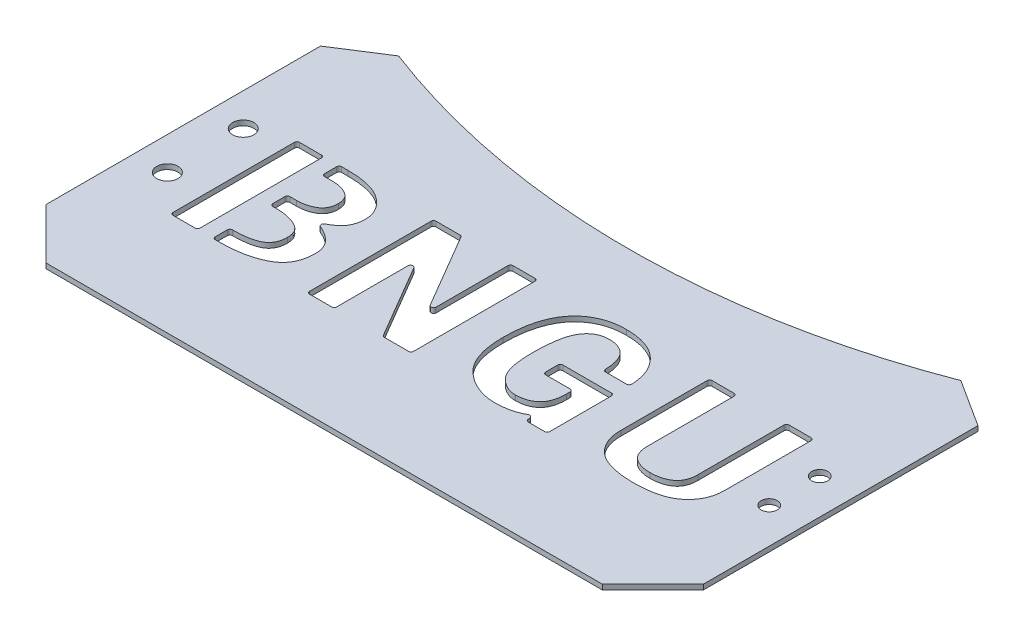
from build123d import *

# Parameters (mm, degrees)
SKETCH_1_W            = 130
SKETCH_1_H            = 75
EXTRUDE_1_DEPTH       = 1
SKETCH_2_R            = 155
CUT_EXTRUDE_1_DEPTH   = 10
CHAMFER_1_SIZE        = 10
SKETCH_3_R            = 2.1
SKETCH_3_R_2          = 1.6
CUT_EXTRUDE_2_DEPTH   = 10
CUT_EXTRUDE_START     = -2
CUT_EXTRUDE_4_DEPTH   = 3
CUT_EXTRUDE_START_2   = -1
CUT_EXTRUDE_4_2_DEPTH = 1
CUT_EXTRUDE_4_3_DEPTH = 1
SKETCH_5_W            = 3
SKETCH_5_H            = 25
EXTRUDE_2_DEPTH       = 1
FILLET_2_R            = 0.5


with BuildPart() as part:
    # 草图1 → 凸台-拉伸1 (new body)
    with BuildSketch(Plane(origin=(0, 0, 0), x_dir=(1, 0, 0), z_dir=(0, 1, 0))):
        with Locations((65, 37.5)):
            Rectangle(SKETCH_1_W, SKETCH_1_H)
    extrude(amount=EXTRUDE_1_DEPTH)

    # 草图2 → 切除-拉伸1 (cut)
    with BuildSketch(Plane(origin=(0, 1, 0), x_dir=(1, 0, 0), z_dir=(0, 1, 0))):
        with Locations((65, 215)):
            Circle(SKETCH_2_R)
    extrude(amount=-CUT_EXTRUDE_1_DEPTH, mode=Mode.SUBTRACT)

    # 倒角1
    # the kernel refuses this chamfer: 10 mm, written as the material it takes off along each edge
    with BuildSketch(Plane(origin=(0, -26.132062539, -74.287527205), x_dir=(0, 0, 1), z_dir=(0, 1, 0))) as chamfer_1_piece_1:
        with BuildLine():
            Line((CHAMFER_1_SIZE, 0), (3.978000417, 9.41522725))
            ThreePointArc((3.978000417, 9.41522725), (2.110742206, 4.779328659), (0, 0))
            Line((0, 0), (CHAMFER_1_SIZE, 0))
        make_face()
    extrude(amount=53.264125079, mode=Mode.SUBTRACT)
    with BuildSketch(Plane(origin=(130, -26.132062539, -74.287527205), x_dir=(0, 0, 1), z_dir=(0, 1, 0))) as chamfer_1_piece_2:
        with BuildLine():
            Line((CHAMFER_1_SIZE, 0), (3.978000417, -9.41522725))
            ThreePointArc((3.978000417, -9.41522725), (2.110742206, -4.779328659), (0, 0))
            Line((0, 0), (CHAMFER_1_SIZE, 0))
        make_face()
    extrude(amount=53.264125079, mode=Mode.SUBTRACT)
    with BuildSketch(Plane(origin=(130, -25.71682988, 0), x_dir=(-1, 0, 0), z_dir=(0, 1, 0))) as chamfer_1_piece_3:
        Polygon((CHAMFER_1_SIZE, 0), (0, -CHAMFER_1_SIZE), (0, 0), align=None)
    extrude(amount=52.433659759, mode=Mode.SUBTRACT)
    with BuildSketch(Plane(origin=(0, -25.71682988, 0), x_dir=(1, 0, 0), z_dir=(0, 1, 0))) as chamfer_1_piece_4:
        Polygon((CHAMFER_1_SIZE, 0), (0, CHAMFER_1_SIZE), (0, 0), align=None)
    extrude(amount=52.433659759, mode=Mode.SUBTRACT)

    # 草图3 → 切除-拉伸2 (cut)
    with BuildSketch(Plane(origin=(0, 1, 0), x_dir=(1, 0, 0), z_dir=(0, 1, 0))):
        with Locations(Location((6.5, 42.5, 0), (0, 0, 270))):
            Circle(SKETCH_3_R)
        with Locations(Location((6.5, 27.5, 0), (0, 0, 270))):
            Circle(SKETCH_3_R)
        with Locations(Location((123, 40, 0), (0, 0, 270))):
            Circle(SKETCH_3_R_2)
        with Locations(Location((123, 30, 0), (0, 0, 270))):
            Circle(SKETCH_3_R_2)
    extrude(amount=-CUT_EXTRUDE_2_DEPTH, mode=Mode.SUBTRACT)

    # 切除-拉伸4: read off the stored shape, not the designer's step
    # 切除-拉伸4 outline → 切除-拉伸4 (cut)
    with BuildSketch(Plane(origin=(0, 1, 0), x_dir=(1, 0, 0), z_dir=(0, 1, 0)).offset(CUT_EXTRUDE_START)):
        with BuildLine():
            add(Edge.make_bspline(
                [(116.063532947, 28.166988624), (116.057192042, 27.883930004), (116.044812515, 27.331306767), (115.922044318, 26.521952572), (115.725747652, 25.755294927), (115.449111567, 25.027888373), (115.096143998, 24.342898255), (114.652061594, 23.706177355), (114.144232404, 23.101601638), (113.548858846, 22.545977268), (112.86986428, 22.044697624), (112.098907478, 21.607876999), (111.239236611, 21.23795111), (110.283790651, 20.947353164), (109.244132409, 20.710422452), (108.111652791, 20.549437286), (106.891526925, 20.444418805), (106.047315121, 20.434438821), (105.610646061, 20.429276669)],
                knots=[0, 0, 0, 0, 0.057606053, 0.112465904, 0.166267195, 0.21849059, 0.270622449, 0.322754308, 0.376247712, 0.431136575, 0.488177917, 0.547722751, 0.611189064, 0.678352216, 0.75080903, 0.828127925, 0.911099067, 1, 1, 1, 1], degree=3))
            Line((116.063532947, 28.166988624), (116.063532947, 45.713672462))
            Line((116.063532947, 45.713672462), (110.713672462, 45.713672462))
            Line((110.713672462, 45.713672462), (110.713672462, 28.166988624))
            add(Edge.make_bspline(
                [(105.610646061, 23.815196394), (105.800309969, 23.818334705), (106.169553382, 23.824444463), (106.708231203, 23.870404409), (107.215789081, 23.96137352), (107.697807881, 24.066175339), (108.146667307, 24.22391612), (108.572672211, 24.395213821), (108.965341848, 24.612138371), (109.325835252, 24.860598369), (109.659542865, 25.135723994), (109.935545294, 25.464937776), (110.185045369, 25.819296489), (110.37227815, 26.221633738), (110.533178929, 26.652385273), (110.63706226, 27.125534223), (110.702249028, 27.633904249), (110.709796598, 27.986118085), (110.713672462, 28.166988624)],
                knots=[0, 0, 0, 0, 0.074422878, 0.144888702, 0.21180878, 0.276669399, 0.338145927, 0.398232677, 0.456652738, 0.513690587, 0.569945868, 0.625668911, 0.681731236, 0.739485653, 0.799206506, 0.861857597, 0.929060451, 1, 1, 1, 1], degree=3))
            add(Edge.make_bspline(
                [(100.851040996, 28.166988624), (100.8553661, 27.977245834), (100.863712135, 27.611104406), (100.921620885, 27.08278416), (101.022433778, 26.597000171), (101.16645085, 26.153290963), (101.355342629, 25.753737658), (101.582992925, 25.394032486), (101.8501067, 25.075678795), (102.163772151, 24.805198635), (102.504878131, 24.571032965), (102.876542284, 24.370688369), (103.271375159, 24.19946188), (103.69258233, 24.062214509), (104.133984119, 23.944953664), (104.603752707, 23.875177415), (105.097934511, 23.823271974), (105.43699421, 23.817931537), (105.610646061, 23.815196394)],
                knots=[0, 0, 0, 0, 0.077065754, 0.148711658, 0.215539497, 0.278260375, 0.3377329, 0.394568739, 0.450755432, 0.50584162, 0.562267356, 0.618510386, 0.677084165, 0.736817934, 0.798315038, 0.862335277, 0.929494027, 1, 1, 1, 1], degree=3))
            Line((100.851040996, 28.166988624), (100.851040996, 45.713672462))
            Line((100.851040996, 45.713672462), (95.501180511, 45.713672462))
            Line((95.501180511, 45.713672462), (95.501180511, 28.166988624))
            add(Edge.make_bspline(
                [(105.610646061, 20.429276669), (105.191940478, 20.435290769), (104.380177209, 20.446950573), (103.205486092, 20.541017013), (102.118064786, 20.709045345), (101.112890912, 20.929272192), (100.195789242, 21.22449067), (99.359060918, 21.577989057), (98.609703349, 22.000321988), (97.950353748, 22.493723601), (97.372964163, 23.039477347), (96.868717983, 23.631001493), (96.449088521, 24.277449871), (96.097685957, 24.964714028), (95.827756668, 25.699931831), (95.643159777, 26.482041981), (95.519778802, 27.308100876), (95.507465048, 27.876762394), (95.501180511, 28.166988624)],
                knots=[0, 0, 0, 0, 0.086825254, 0.168332008, 0.244136288, 0.314865598, 0.3814941, 0.443641672, 0.502945796, 0.559400955, 0.613978807, 0.667408917, 0.72018612, 0.773435671, 0.827182861, 0.882151317, 0.939853889, 1, 1, 1, 1], degree=3))
        make_face()
        with BuildLine():
            add(Edge.make_bspline(
                [(84.137153896, 22.42004722), (84.120342777, 22.358077737), (84.085378654, 22.229192284), (83.970677764, 22.048081956), (83.804015819, 21.875517016), (83.586963373, 21.706043635), (83.323666256, 21.534510074), (83.009363536, 21.367853594), (82.641852705, 21.209272818), (82.085358891, 20.994220643), (81.333490055, 20.769312454), (80.393402441, 20.570373117), (79.414735309, 20.44862376), (78.75008353, 20.435803897), (78.411676325, 20.429276669)],
                knots=[0, 0, 0, 0, 0.030348462, 0.063119378, 0.100370879, 0.143874274, 0.193576006, 0.249427436, 0.312547593, 0.383520624, 0.532625821, 0.684532024, 0.839379598, 1, 1, 1, 1], degree=3))
            Line((84.137153896, 22.42004722), (84.534234814, 20.429276669))
            Line((84.534234814, 20.429276669), (88.676754668, 20.429276669))
            Line((88.676754668, 20.429276669), (88.676754668, 33.629534235))
            Line((88.676754668, 33.629534235), (78.06825499, 33.629534235))
            Line((78.06825499, 33.629534235), (78.06825499, 30.238248551))
            Line((78.06825499, 30.238248551), (83.890319811, 30.238248551))
            Line((83.890319811, 30.238248551), (83.890319811, 29.020176003))
            add(Edge.make_bspline(
                [(78.975101953, 23.815196394), (79.161299754, 23.819483702), (79.525702533, 23.827874278), (80.056578865, 23.888435493), (80.558953477, 23.981259058), (81.025513068, 24.124890327), (81.467157777, 24.29173572), (81.867627281, 24.516504784), (82.244037921, 24.769672897), (82.588644327, 25.0645182), (82.89616294, 25.405799986), (83.166128031, 25.788621257), (83.393738924, 26.21748476), (83.573003841, 26.692877232), (83.719861312, 27.211170671), (83.819135252, 27.775654293), (83.877589497, 28.38396236), (83.88598651, 28.803613747), (83.890319811, 29.020176003)],
                knots=[0, 0, 0, 0, 0.068189377, 0.133451623, 0.195514404, 0.255006289, 0.312067396, 0.368069228, 0.422768152, 0.478056409, 0.533719951, 0.590615313, 0.649234943, 0.711044752, 0.776382595, 0.846293993, 0.920679591, 1, 1, 1, 1], degree=3))
            add(Edge.make_bspline(
                [(73.464262717, 32.717321314), (73.468844868, 32.298618019), (73.477626855, 31.496146135), (73.559377768, 30.344492057), (73.686230152, 29.298105238), (73.88166181, 28.359159708), (74.117407911, 27.523449787), (74.411500505, 26.790430515), (74.761669702, 26.162726397), (75.173985784, 25.645675984), (75.614044271, 25.215190891), (76.065841336, 24.845684574), (76.522106115, 24.524536069), (76.991335062, 24.264650375), (77.472651194, 24.065435488), (77.962899043, 23.918648563), (78.465640338, 23.829377755), (78.804824879, 23.819936222), (78.975101953, 23.815196394)],
                knots=[0, 0, 0, 0, 0.106838532, 0.204762941, 0.294503275, 0.375611329, 0.449285761, 0.515827233, 0.576748549, 0.63199848, 0.683966024, 0.733587143, 0.780818079, 0.826174366, 0.870171136, 0.913499803, 0.95657526, 1, 1, 1, 1], degree=3))
            add(Edge.make_bspline(
                [(78.787293411, 42.61214853), (78.581163382, 42.606707429), (78.178744488, 42.596085001), (77.592309404, 42.491150779), (77.043165666, 42.318484405), (76.524576102, 42.083493194), (76.053407966, 41.764235634), (75.604770233, 41.393935922), (75.205086306, 40.942764973), (74.833765463, 40.425824164), (74.500712998, 39.821651542), (74.229667845, 39.111406603), (73.985124041, 38.303778458), (73.79982734, 37.386647352), (73.642293241, 36.368260519), (73.540287435, 35.242815644), (73.475173822, 34.014878826), (73.467993604, 33.161001441), (73.464262717, 32.717321314)],
                knots=[0, 0, 0, 0, 0.048895668, 0.095456935, 0.140847685, 0.185301326, 0.230052062, 0.27555587, 0.323054416, 0.37266024, 0.426439089, 0.486283904, 0.552778561, 0.626561671, 0.708170391, 0.797317644, 0.894684957, 1, 1, 1, 1], degree=3))
            add(Edge.make_bspline(
                [(83.514702726, 36.639836875), (83.509788144, 36.895682546), (83.500291548, 37.390060941), (83.450272182, 38.103883181), (83.353222756, 38.761832697), (83.219923192, 39.364710595), (83.052389039, 39.915192274), (82.83543634, 40.404254796), (82.589711946, 40.842308141), (82.295946211, 41.219257303), (81.970836589, 41.549210201), (81.615604734, 41.839144241), (81.218993964, 42.070675395), (80.798742643, 42.276597416), (80.339683708, 42.420209984), (79.853050829, 42.537942034), (79.330853027, 42.599970191), (78.971662658, 42.608017775), (78.787293411, 42.61214853)],
                knots=[0, 0, 0, 0, 0.087979942, 0.170006326, 0.245849037, 0.316424574, 0.382169602, 0.443302959, 0.500056848, 0.554428192, 0.607049665, 0.659107475, 0.711527305, 0.76462105, 0.819659595, 0.876496727, 0.93660686, 1, 1, 1, 1], degree=3))
            Line((83.514702726, 36.639836875), (88.676754668, 36.639836875))
            add(Edge.make_bspline(
                [(78.787293411, 45.998068255), (79.168695907, 45.992457613), (79.910388624, 45.981546902), (80.989776911, 45.850744055), (82.006567138, 45.660151406), (82.954412703, 45.372931346), (83.83753396, 45.011782482), (84.658721802, 44.573881664), (85.406583597, 44.041558629), (86.091608063, 43.441935784), (86.694146682, 42.768033755), (87.230298648, 42.049463722), (87.679902728, 41.273326132), (88.043710327, 40.44458512), (88.328493963, 39.56535601), (88.533598863, 38.636749972), (88.650542776, 37.655208624), (88.66788128, 36.983565878), (88.676754668, 36.639836875)],
                knots=[0, 0, 0, 0, 0.074230007, 0.144351063, 0.211431196, 0.275452934, 0.336836518, 0.396992327, 0.456230572, 0.515210205, 0.573902189, 0.631932081, 0.689522318, 0.748158465, 0.807858778, 0.869212709, 0.933066522, 1, 1, 1, 1], degree=3))
            add(Edge.make_bspline(
                [(67.92659369, 32.43292552), (67.933232733, 32.982398455), (67.94612314, 34.049258504), (68.090923196, 35.593851151), (68.308299618, 37.034058745), (68.631953406, 38.36324017), (69.037598224, 39.589818856), (69.534376907, 40.710733902), (70.127050205, 41.723675302), (70.813388528, 42.625013536), (71.576964524, 43.420167318), (72.408014888, 44.115224885), (73.311612639, 44.695294247), (74.275473202, 45.179173771), (75.312550193, 45.540677281), (76.409180702, 45.812269711), (77.577324817, 45.967292032), (78.377244167, 45.987638425), (78.787293411, 45.998068255)],
                knots=[0, 0, 0, 0, 0.083479314, 0.162083952, 0.235554303, 0.304648186, 0.369719466, 0.431653755, 0.490627754, 0.547658393, 0.603411494, 0.65784487, 0.711905712, 0.766245345, 0.821356615, 0.878450705, 0.937692223, 1, 1, 1, 1], degree=3))
            add(Edge.make_bspline(
                [(78.411676325, 20.429276669), (78.076751984, 20.437058903), (77.41132543, 20.452520621), (76.428250067, 20.590650044), (75.472120868, 20.815911163), (74.545946044, 21.135353507), (73.646737381, 21.540216168), (72.770727354, 22.029330172), (71.930267795, 22.620508913), (71.113332607, 23.284422575), (70.353391579, 24.049030457), (69.705453271, 24.939965643), (69.147748451, 25.929123891), (68.697695406, 27.027478977), (68.352768727, 28.230351781), (68.1013702, 29.537342426), (67.951070684, 30.950182088), (67.934926518, 31.928147601), (67.92659369, 32.43292552)],
                knots=[0, 0, 0, 0, 0.055847372, 0.110957371, 0.16523641, 0.219492482, 0.274115691, 0.329556674, 0.386584776, 0.445304259, 0.505016026, 0.565826955, 0.628484522, 0.69403566, 0.763342469, 0.836898692, 0.91581509, 1, 1, 1, 1], degree=3))
        make_face()
        with BuildLine():
            add(Edge.make_bspline(
                [(29.207984546, 33.752951277), (29.537737531, 33.706550542), (30.207090439, 33.612363473), (31.190636544, 33.261398841), (32.163829676, 32.760334515), (32.957069118, 32.235235883), (33.547657251, 31.735737093), (33.95263725, 31.337145575), (34.278693088, 30.894070316), (34.558289931, 30.433720229), (34.764833968, 29.938376267), (34.92709439, 29.420783702), (35.008538997, 28.870692118), (35.022812847, 28.496307903), (35.030049367, 28.306503542)],
                knots=[0, 0, 0, 0, 0.114502474, 0.23242417, 0.357566387, 0.491244956, 0.559034443, 0.623973289, 0.686470741, 0.748095944, 0.80911716, 0.870927017, 0.934562906, 1, 1, 1, 1], degree=3))
            add(Edge.make_bspline(
                [(34.091006654, 39.113543679), (34.08625347, 38.900401693), (34.077030289, 38.486816348), (33.994541502, 37.888373696), (33.864241302, 37.330369848), (33.666215876, 36.817947783), (33.426193437, 36.338826634), (33.124443155, 35.905511898), (32.770687473, 35.510528539), (32.236326137, 35.066877176), (31.554811568, 34.597555621), (30.742534091, 34.166220436), (29.970221314, 33.857274762), (29.453526584, 33.786557372), (29.207984546, 33.752951277)],
                knots=[0, 0, 0, 0, 0.080201968, 0.155625642, 0.22699672, 0.295406144, 0.361961054, 0.428270247, 0.49358733, 0.560927895, 0.68924546, 0.804313286, 0.907006378, 1, 1, 1, 1], degree=3))
            add(Edge.make_bspline(
                [(24.013736853, 45.713672462), (24.419933601, 45.707404749), (25.206570745, 45.695266751), (26.346576221, 45.604662217), (27.408519398, 45.451546834), (28.392840868, 45.230970523), (29.303553053, 44.956278264), (30.133309017, 44.611615347), (30.887683342, 44.209386586), (31.557815462, 43.740112181), (32.149072818, 43.231426872), (32.670448149, 42.705252093), (33.107435618, 42.156250226), (33.465841186, 41.587726353), (33.749009212, 41.000062445), (33.948091935, 40.388480591), (34.070808534, 39.757030625), (34.08425234, 39.328727693), (34.091006654, 39.113543679)],
                knots=[0, 0, 0, 0, 0.090950622, 0.176134197, 0.255887699, 0.331000567, 0.401820805, 0.468615855, 0.531875772, 0.592873828, 0.651391416, 0.706337655, 0.758505765, 0.808178771, 0.856549361, 0.904172954, 0.951855458, 1, 1, 1, 1], degree=3))
            Line((24.013736853, 45.713672462), (13.904271303, 45.713672462))
            Line((13.904271303, 45.713672462), (13.904271303, 20.713672462))
            Line((13.904271303, 20.713672462), (23.638119768, 20.713672462))
            add(Edge.make_bspline(
                [(35.030049367, 28.306503542), (35.022516612, 27.965976476), (35.007959052, 27.307884783), (34.847294648, 26.362376878), (34.597248118, 25.496227049), (34.248898551, 24.705682212), (33.784780726, 24.000505987), (33.223862488, 23.372777871), (32.557134778, 22.830169955), (31.797491318, 22.373333765), (30.960938355, 21.987828439), (30.072206061, 21.644222019), (29.128962467, 21.354371548), (28.133985152, 21.119201036), (27.085647912, 20.93706625), (25.983631416, 20.811879475), (24.828872766, 20.727799549), (24.040721923, 20.718448932), (23.638119768, 20.713672462)],
                knots=[0, 0, 0, 0, 0.065709743, 0.126988542, 0.184596459, 0.239489864, 0.293146464, 0.346966286, 0.401460398, 0.45851462, 0.517701184, 0.579160831, 0.642427866, 0.708119445, 0.776499153, 0.84780077, 0.922253794, 1, 1, 1, 1], degree=3))
        make_face()
        Polygon((46.442369607, 45.713672462), (40.915432496, 45.713672462), (40.915432496, 20.713672462), (46.265292981, 20.713672462), (46.265292981, 37.146282994), (55.891822279, 20.713672462), (61.477784932, 20.713672462), (61.477784932, 45.713672462), (56.127924447, 45.713672462), (56.127924447, 29.180304563), align=None)
    extrude(amount=CUT_EXTRUDE_4_DEPTH, mode=Mode.SUBTRACT)



with BuildPart() as body_2:
    # Cut-Extrude 4 2 outline → Cut-Extrude 4 2 (new body)
    with BuildSketch(Plane(origin=(0, 1, 0), x_dir=(1, 0, 0), z_dir=(0, 1, 0)).offset(CUT_EXTRUDE_START_2)):
        with BuildLine():
            add(Edge.make_bspline(
                [(22.886885598, 24.099592187), (23.153461025, 24.102835613), (23.669081974, 24.109109179), (24.415541785, 24.152742543), (25.112598943, 24.220069862), (25.757387538, 24.321500165), (26.353312821, 24.44858845), (26.895002731, 24.608791833), (27.386505396, 24.797412126), (27.830997052, 25.008892613), (28.225179677, 25.263655911), (28.565771785, 25.565538676), (28.852758558, 25.914555831), (29.093043658, 26.304889101), (29.274210291, 26.74371729), (29.402463247, 27.225377625), (29.477144349, 27.751485801), (29.487168869, 28.116659747), (29.492380339, 28.306503542)],
                knots=[0, 0, 0, 0, 0.089294249, 0.172716539, 0.250400805, 0.323788591, 0.391247657, 0.454376853, 0.512795045, 0.567460786, 0.618978854, 0.66948349, 0.71927222, 0.769830141, 0.822464999, 0.877695886, 0.936417487, 1, 1, 1, 1], degree=3))
            add(Edge.make_bspline(
                [(29.492380339, 28.306503542), (29.487837261, 28.471426187), (29.478980886, 28.792929992), (29.392835563, 29.256081634), (29.245865741, 29.682657735), (29.042258562, 30.070817801), (28.778011321, 30.420475524), (28.460518295, 30.73498976), (28.077530318, 31.001941756), (27.497866865, 31.318117892), (26.693373055, 31.618462875), (25.672640983, 31.899378178), (24.582205412, 32.05981878), (23.833583454, 32.07945237), (23.450311226, 32.089504185)],
                knots=[0, 0, 0, 0, 0.061873337, 0.120617234, 0.176047181, 0.230719377, 0.284442996, 0.340002966, 0.397771471, 0.459084691, 0.587530774, 0.718992508, 0.856132502, 1, 1, 1, 1], degree=3))
            Line((23.450311226, 32.089504185), (19.254131788, 32.089504185))
            Line((19.254131788, 32.089504185), (19.254131788, 24.099592187))
            Line((19.254131788, 24.099592187), (22.886885598, 24.099592187))
        make_face()
    extrude(amount=CUT_EXTRUDE_4_2_DEPTH)


with BuildPart() as body_3:
    # Cut-Extrude 4 3 outline → Cut-Extrude 4 3 (new body)
    with BuildSketch(Plane(origin=(0, 1, 0), x_dir=(1, 0, 0), z_dir=(0, 1, 0)).offset(CUT_EXTRUDE_START_2)):
        with BuildLine():
            add(Edge.make_bspline(
                [(24.013736853, 35.475423911), (24.331086331, 35.484837679), (24.945119675, 35.503052196), (25.827522489, 35.668268665), (26.636494586, 35.930007373), (27.25154734, 36.237326723), (27.686642118, 36.544059889), (27.969750229, 36.811638293), (28.212927979, 37.111337886), (28.406894065, 37.449360195), (28.558013458, 37.817512578), (28.66502779, 38.21958276), (28.729741092, 38.655332457), (28.737267159, 38.957700279), (28.741146169, 39.113543679)],
                knots=[0, 0, 0, 0, 0.140761398, 0.272356496, 0.396894958, 0.517273752, 0.575884423, 0.632614864, 0.689655613, 0.746580195, 0.804969947, 0.865833764, 0.930849379, 1, 1, 1, 1], degree=3))
            add(Edge.make_bspline(
                [(28.741146169, 39.113543679), (28.736622499, 39.246080338), (28.727773486, 39.505343037), (28.670738061, 39.881045579), (28.566570902, 40.2281546), (28.427619754, 40.549274234), (28.242891406, 40.842272243), (28.014973237, 41.105813977), (27.749858226, 41.343803751), (27.340453666, 41.625412325), (26.75603533, 41.91010961), (25.979460111, 42.158881505), (25.117256186, 42.302605706), (24.515106137, 42.319141807), (24.201545396, 42.327752737)],
                knots=[0, 0, 0, 0, 0.063422479, 0.124064415, 0.181199025, 0.23637728, 0.290988495, 0.346219818, 0.402580036, 0.460982486, 0.583456211, 0.712013178, 0.850035117, 1, 1, 1, 1], degree=3))
            Line((24.201545396, 42.327752737), (19.254131788, 42.327752737))
            Line((19.254131788, 42.327752737), (19.254131788, 35.475423911))
            Line((19.254131788, 35.475423911), (24.013736853, 35.475423911))
        make_face()
    extrude(amount=CUT_EXTRUDE_4_3_DEPTH)


with BuildPart() as part_1:
    add(part.part)

    add(body_2.part)  # 凸台-拉伸2 merges body 2

    add(body_3.part)  # 凸台-拉伸2 merges body 3
    # 草图5 → 凸台-拉伸2 (add)
    with BuildSketch(Plane(origin=(0, 1, 0), x_dir=(1, 0, 0), z_dir=(0, 1, 0))):
        with Locations((20.754131788, 33.213672462)):
            Rectangle(SKETCH_5_W, SKETCH_5_H)
    extrude(amount=-EXTRUDE_2_DEPTH)

    # 圆角2
    fillet_2_edges = [part_1.edges().sort_by_distance(p)[0] for p in [
        (22.254131788, 0.5, -45.713672462),
        (22.254131788, 0.5, -42.327752737),
        (22.254131788, 0.5, -20.713672462),
        (22.254131788, 0.5, -24.099592187),
        (22.254131788, 0.5, -32.089504185),
        (22.254131788, 0.5, -35.475423911),
        (29.207984546, 0.5, -33.752951277),
        (105.610646061, 0.5, -20.429276669),
        (95.501180511, 0.5, -28.166988624),
        (100.851040996, 0.5, -45.713672462),
        (100.851040996, 0.5, -28.166988624),
        (105.610646061, 0.5, -23.815196394),
        (110.713672462, 0.5, -28.166988624),
        (110.713672462, 0.5, -45.713672462),
        (116.063532947, 0.5, -45.713672462),
        (116.063532947, 0.5, -28.166988624),
        (95.501180511, 0.5, -45.713672462),
        (84.534234814, 0.5, -20.429276669),
        (84.137153896, 0.5, -22.42004722),
        (78.411676325, 0.5, -20.429276669),
        (67.92659369, 0.5, -32.43292552),
        (78.787293411, 0.5, -45.998068255),
        (88.676754668, 0.5, -36.639836875),
        (83.514702726, 0.5, -36.639836875),
        (78.787293411, 0.5, -42.61214853),
        (73.464262717, 0.5, -32.717321314),
        (78.975101953, 0.5, -23.815196394),
        (83.890319811, 0.5, -29.020176003),
        (83.890319811, 0.5, -30.238248551),
        (78.06825499, 0.5, -30.238248551),
        (88.676754668, 0.5, -33.629534235),
        (88.676754668, 0.5, -20.429276669),
        (78.06825499, 0.5, -33.629534235),
        (55.891822279, 0.5, -20.713672462),
        (46.265292981, 0.5, -37.146282994),
        (46.265292981, 0.5, -20.713672462),
        (40.915432496, 0.5, -20.713672462),
        (46.442369607, 0.5, -45.713672462),
        (56.127924447, 0.5, -29.180304563),
        (56.127924447, 0.5, -45.713672462),
        (61.477784932, 0.5, -45.713672462),
        (61.477784932, 0.5, -20.713672462),
        (40.915432496, 0.5, -45.713672462),
        (13.904271303, 0.5, -20.713672462),
        (19.254131788, 0.5, -45.713672462),
        (19.254131788, 0.5, -20.713672462),
        (13.904271303, 0.5, -45.713672462),
    ]]
    fillet(fillet_2_edges, radius=FILLET_2_R)


solid = part_1.part
